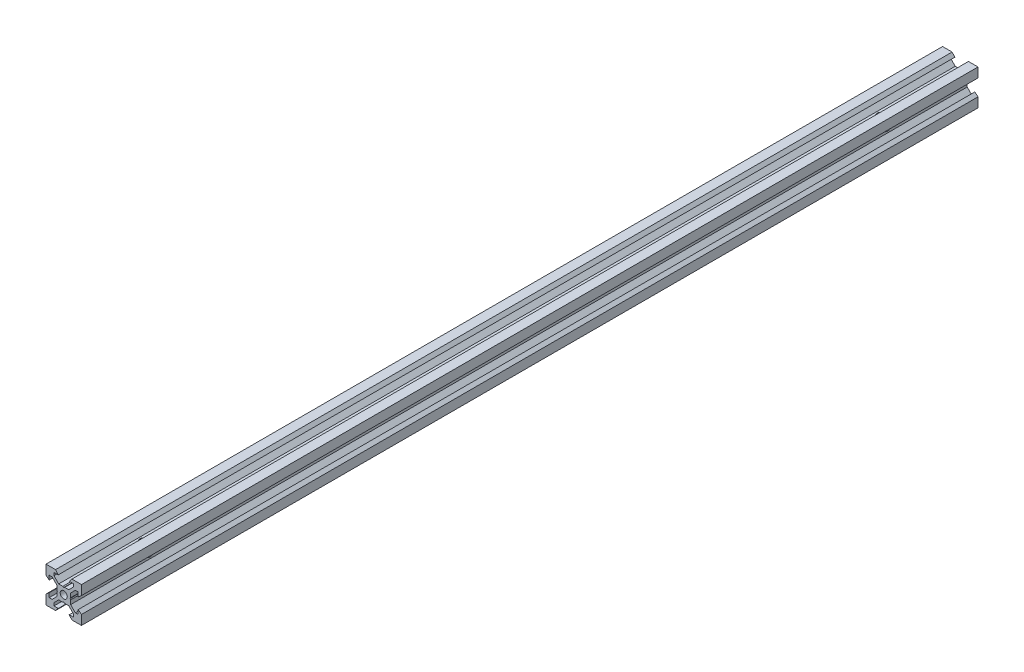
from build123d import *

# Parameters (mm, degrees)
SKETCH1_R               = 2
BOSS_EXTRUDE1_DEPTH     = 506
CUT_EXTRUDE1_DEPTH      = 507.289650299
CUT_EXTRUDE1_DEPTH_BACK = 507.289650299
SKETCH2_R               = 2
CUT_EXTRUDE2_DEPTH      = 507.289650299
CUT_EXTRUDE2_DEPTH_BACK = 507.289650299
SKETCH3_R               = 2


with BuildPart() as part:
    # Sketch1 → Boss-Extrude1 (new body)
    with BuildSketch(Plane.XY):
        Polygon((10, 4.610379336), (10, 10), (4.610379336, 10), (3.1, 8.2), (5.5, 8.2), (5.5, 6.560660172), (2.839339828, 3.9), (0.519615242, 3.9), (0, 3.6), (-0.519615242, 3.9), (-2.839339828, 3.9), (-5.5, 6.560660172), (-5.5, 8.2), (-3.1, 8.2), (-4.610379336, 10), (-10, 10), (-10, 4.610379336), (-8.2, 3.1), (-8.2, 5.5), (-6.560660172, 5.5), (-3.9, 2.839339828), (-3.9, 0.519615242), (-3.6, 0), (-3.9, -0.519615242), (-3.9, -2.839339828), (-6.560660172, -5.5), (-8.2, -5.5), (-8.2, -3.1), (-10, -4.610379336), (-10, -10), (-4.610379336, -10), (-3.1, -8.2), (-5.5, -8.2), (-5.5, -6.560660172), (-2.839339828, -3.9), (-0.519615242, -3.9), (0, -3.6), (0.519615242, -3.9), (2.839339828, -3.9), (5.5, -6.560660172), (5.5, -8.2), (3.1, -8.2), (4.610379336, -10), (10, -10), (10, -4.610379336), (8.2, -3.1), (8.2, -5.5), (6.560660172, -5.5), (3.9, -2.839339828), (3.9, -0.519615242), (3.6, 0), (3.9, 0.519615242), (3.9, 2.839339828), (6.560660172, 5.5), (8.2, 5.5), (8.2, 3.1), align=None)
        Circle(SKETCH1_R, mode=Mode.SUBTRACT)
    extrude(amount=BOSS_EXTRUDE1_DEPTH)

    # Sketch2 → Cut-Extrude1 (cut, two sides: drawn at the far end of the back side and taken through both)
    with BuildSketch(Plane(origin=(0, -3.9, 0), x_dir=(-1, 0, 0), z_dir=(0, -1, 0)).offset(-CUT_EXTRUDE1_DEPTH_BACK)):
        with Locations((0, -461)):
            Circle(SKETCH2_R)
        with Locations((0, -45)):
            Circle(SKETCH2_R)
    extrude(amount=CUT_EXTRUDE1_DEPTH + CUT_EXTRUDE1_DEPTH_BACK, mode=Mode.SUBTRACT)

    # Sketch3 → Cut-Extrude2 (cut, two sides: drawn at the far end of the back side and taken through both)
    with BuildSketch(Plane(origin=(3.9, 0, 0), x_dir=(0, 0, -1), z_dir=(1, 0, 0)).offset(-CUT_EXTRUDE2_DEPTH_BACK)):
        with Locations((-45, 0)):
            Circle(SKETCH3_R)
        with Locations((-461, 0)):
            Circle(SKETCH3_R)
    extrude(amount=CUT_EXTRUDE2_DEPTH + CUT_EXTRUDE2_DEPTH_BACK, mode=Mode.SUBTRACT)


solid = part.part
